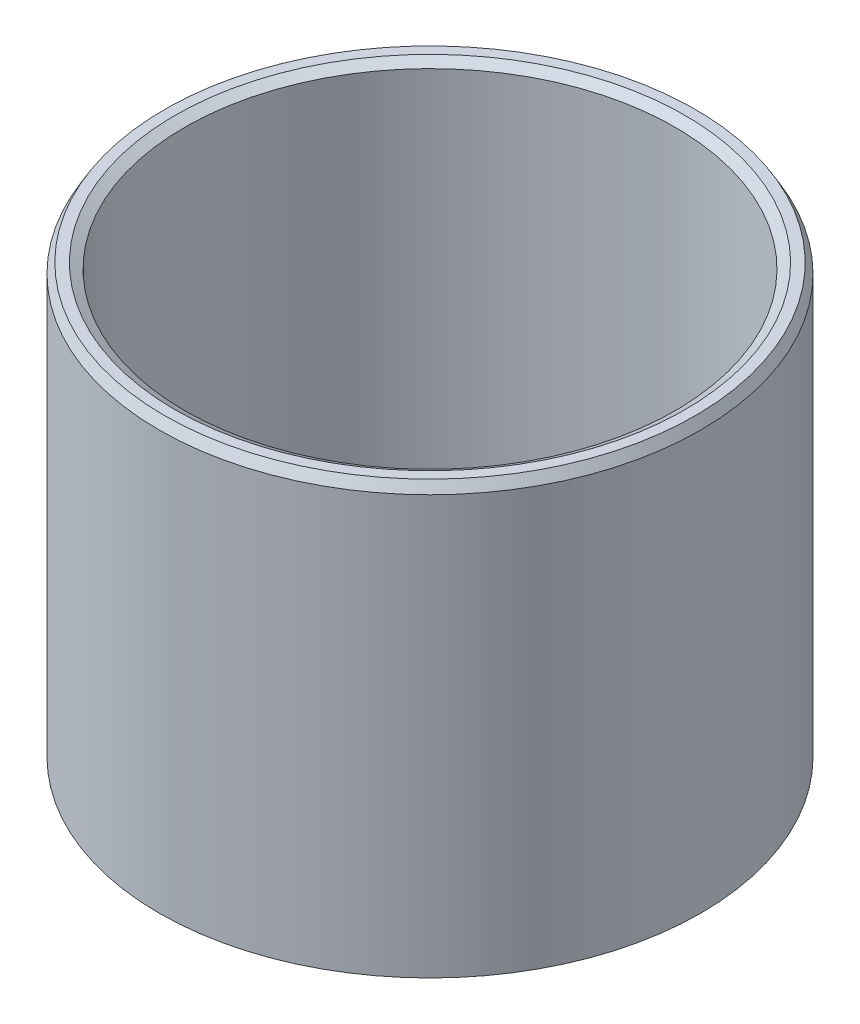
from build123d import *
from OCP.BRepFilletAPI import BRepFilletAPI_MakeChamfer

# Parameters (mm, degrees)
SKETCH1_R           = 52.5
BOSS_EXTRUDE1_DEPTH = 84.053609311
SKETCH2_R           = 47.560873735
CUT_EXTRUDE1_DEPTH  = 113.149495042
CHAMFER1_SIZE       = 1.863826615
CHAMFER1_SIZE2      = 1.076080798


with BuildPart() as part:
    # Sketch1 → Boss-Extrude1 (new body)
    with BuildSketch(Plane(origin=(0, 0, 0), x_dir=(1, 0, 0), z_dir=(0, 1, 0))):
        Circle(SKETCH1_R)
    extrude(amount=BOSS_EXTRUDE1_DEPTH)

    # Sketch2 → Cut-Extrude1 (cut, through all)
    with BuildSketch(Plane(origin=(0, 0, 0), x_dir=(1, 0, 0), z_dir=(0, 1, 0))):
        Circle(SKETCH2_R)
    extrude(amount=CUT_EXTRUDE1_DEPTH, mode=Mode.SUBTRACT)

    # Chamfer1: one chamfer whose edges measure the first distance from different faces: ONE call of the kernel's chamfer builder (chamfer() names one face for all edges)
    chamfer1_edges_1 = [part.edges().sort_by_distance(p)[0] for p in [
        (-47.560873735, 84.053609311, 0),
    ]]
    chamfer1_side_1 = [part.faces().sort_by_distance(p)[0] for p in [
        (-51.01507576, 84.053609311, 0),
    ]]
    chamfer1_edges_2 = [part.edges().sort_by_distance(p)[0] for p in [
        (-47.560873735, 0, 0),
    ]]
    chamfer1_side_2 = [part.faces().sort_by_distance(p)[0] for p in [
        (-47.560873735, 42.026804655, 0),
    ]]
    chamfer1_edges_3 = [part.edges().sort_by_distance(p)[0] for p in [
        (-52.5, 0, 0),
    ]]
    chamfer1_side_3 = [part.faces().sort_by_distance(p)[0] for p in [
        (-51.01507576, 0, 0),
    ]]
    chamfer1_edges_4 = [part.edges().sort_by_distance(p)[0] for p in [
        (-52.5, 84.053609311, 0),
    ]]
    chamfer1_side_4 = [part.faces().sort_by_distance(p)[0] for p in [
        (-52.5, 42.026804655, 0),
    ]]
    chamfer1 = BRepFilletAPI_MakeChamfer(part.part.solid().wrapped)
    for e in chamfer1_edges_1:
        chamfer1.Add(CHAMFER1_SIZE, CHAMFER1_SIZE2, e.wrapped, chamfer1_side_1[0].wrapped)  # the first distance lies on this face
    for e in chamfer1_edges_2:
        chamfer1.Add(CHAMFER1_SIZE, CHAMFER1_SIZE2, e.wrapped, chamfer1_side_2[0].wrapped)  # the first distance lies on this face
    for e in chamfer1_edges_3:
        chamfer1.Add(CHAMFER1_SIZE, CHAMFER1_SIZE2, e.wrapped, chamfer1_side_3[0].wrapped)  # the first distance lies on this face
    for e in chamfer1_edges_4:
        chamfer1.Add(CHAMFER1_SIZE, CHAMFER1_SIZE2, e.wrapped, chamfer1_side_4[0].wrapped)  # the first distance lies on this face
    add(Compound.cast(chamfer1.Shape()), mode=Mode.REPLACE)


solid = part.part
